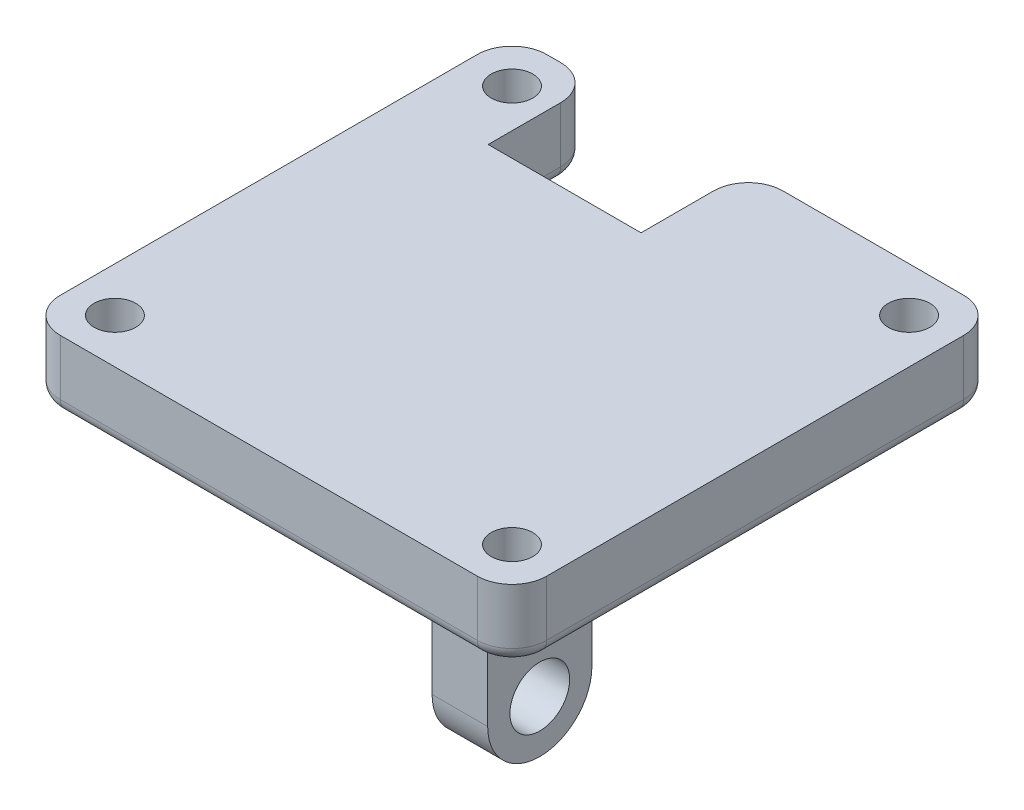
from build123d import *

# Parameters (mm, degrees)
SKETCH_2_W          = 35
SKETCH_2_H          = 35
EXTRUDE_1_DEPTH     = 5
SKETCH_3_R          = 1.5
SKETCH_3_W          = 11
SKETCH_3_H          = 7.715
CUT_EXTRUDE_1_DEPTH = 26.248762346
SKETCH_4_W          = 5
SKETCH_4_H          = 8
EXTRUDE_2_DEPTH     = 1.5
SKETCH_5_W          = 4
SKETCH_5_H          = 7.5
EXTRUDE_3_DEPTH     = 20
FILLET_1_R          = 3.75
SKETCH_6_R          = 2.15
CUT_EXTRUDE_2_DEPTH = 8
FILLET_2_R          = 2.5
FILLET_3_R          = 2.5
FILLET_4_R          = 1
FILLET_5_R          = 1
FILLET_6_R          = 1


# Some blends are built 0.0001 mm under size
with BuildPart() as part:
    # 草图2 → 凸台-拉伸1 (new body)
    with BuildSketch(Plane(origin=(0, 0, 0), x_dir=(1, 0, 0), z_dir=(0, 1, 0))):
        Rectangle(SKETCH_2_W, SKETCH_2_H)
    extrude(amount=EXTRUDE_1_DEPTH)

    # 草图3 → 切除-拉伸1 (cut, through all)
    with BuildSketch(Plane(origin=(0, 5, 0), x_dir=(1, 0, 0), z_dir=(0, 1, 0))):
        with Locations(Location((-14.285, 14.285, 0), (0, 0, 270))):
            Circle(SKETCH_3_R)
        with Locations(Location((-14.285, -14.285, 0), (0, 0, 90))):
            Circle(SKETCH_3_R)
        with Locations(Location((14.285, -14.285, 0), (0, 0, 270))):
            Circle(SKETCH_3_R)
        with Locations(Location((14.285, 14.285, 0), (0, 0, 90))):
            Circle(SKETCH_3_R)
        with Locations((-6, 13.6425)):
            Rectangle(SKETCH_3_W, SKETCH_3_H)
    extrude(amount=-CUT_EXTRUDE_1_DEPTH, mode=Mode.SUBTRACT)

    # 草图4 → 凸台-拉伸2 (add)
    with BuildSketch(Plane.XZ):
        Rectangle(SKETCH_4_W, SKETCH_4_H)
    extrude(amount=EXTRUDE_2_DEPTH)

    # 草图5 → 凸台-拉伸3 (add)
    with BuildSketch(Plane.XZ.offset(1.5)):
        Rectangle(SKETCH_5_W, SKETCH_5_H)
    extrude(amount=EXTRUDE_3_DEPTH)

    # 圆角1
    fillet_1_edges = [part.edges().sort_by_distance(p)[0] for p in [
        (0, -21.5, -3.75),
        (0, -21.5, 3.75),
    ]]
    fillet(fillet_1_edges, radius=FILLET_1_R - 0.0001)  # a hair under: the kernel refuses the full size

    # 草图6 → 切除-拉伸2 (cut)
    with BuildSketch(Plane.ZY.offset(2)):
        with Locations((0, -17.75)):
            Circle(SKETCH_6_R)
    extrude(amount=-CUT_EXTRUDE_2_DEPTH, mode=Mode.SUBTRACT)

    # 圆角2
    fillet_2_edges = [part.edges().sort_by_distance(p)[0] for p in [
        (17.5, 2.5, 17.5),
        (-17.5, 2.5, 17.5),
        (-17.5, 2.5, -17.5),
        (17.5, 2.5, -17.5),
    ]]
    fillet(fillet_2_edges, radius=FILLET_2_R)

    # 圆角3
    fillet_3_edges = [part.edges().sort_by_distance(p)[0] for p in [
        (-11.5, 2.5, -17.5),
        (-0.5, 2.5, -17.5),
    ]]
    fillet(fillet_3_edges, radius=FILLET_3_R)

    # 圆角4
    fillet_4_edges = [part.edges().sort_by_distance(p)[0] for p in [
        (-14.5, 0, -17.5),
        (-11.5, 0, -12.3925),
        (-12.232233047, 0, -16.767766953),
        (0.232233047, 0, -16.767766953),
        (-0.5, 0, -12.3925),
        (-6, 0, -9.785),
        (8.5, 0, -17.5),
        (17.5, 0, 0),
        (0, 0, 17.5),
        (-17.5, 0, 0),
        (-16.767766953, 0, -16.767766953),
        (-16.767766953, 0, 16.767766953),
        (16.767766953, 0, 16.767766953),
        (16.767766953, 0, -16.767766953),
    ]]
    fillet(fillet_4_edges, radius=FILLET_4_R)

    # 圆角5
    fillet_5_edges = [part.edges().sort_by_distance(p)[0] for p in [
        (2.5, 0, 0),
        (0, 0, 4),
        (-2.5, 0, 0),
        (0, 0, -4),
    ]]
    fillet(fillet_5_edges, radius=FILLET_5_R)

    # 圆角6
    # the kernel refuses this fillet: 1 mm, written as the material it takes off along each edge
    with BuildSketch(Plane(origin=(-3.961914255, -1.5, -4), x_dir=(0, 0.9999810692345785, -0.006153143299889555), z_dir=(1, 0, 0)), Plane(origin=(3.961914255, -1.5, 4), x_dir=(0, 0.9999810692345785, 0.006153143299889555), z_dir=(-1, 0, 0))) as fillet_6_piece_1:
        with BuildLine():
            CenterArc((0.663387726, 0.996904498), FILLET_6_R, 228.323350496, 37.167285461)
            Line((-0.001538286, 0.249995267), (-0.068030887, 0.175304344))
            ThreePointArc((-0.068030887, 0.175304344), (-0.10076725, 0.124382319), (-0.099998107, -0.000615314))
            Line((-0.099998107, -0.000615314), (0.000615314, -0.099998107))
            ThreePointArc((0.000615314, -0.099998107), (0.500605849, -0.096921535), (0.5769035, -0.09969045))
            Line((0.5769035, -0.09969045), (0.584765702, 0))
        make_face()
    extrude(amount=7.923828511, mode=Mode.SUBTRACT)
    with BuildSketch(Plane(origin=(-2.5, -1.5, 5.734079277), x_dir=(-0.027211919166029507, 0.9996296871618517, 0), z_dir=(0, 0, -1)), Plane(origin=(2.5, -1.5, -5.734079277), x_dir=(0.02721191916602949, 0.9996296871618517, 0), z_dir=(0, 0, 1))) as fillet_6_piece_2:
        with BuildLine():
            CenterArc((0.860236658, 0.986023728), FILLET_6_R, 209.091705597, 51.317812547)
            Line((-0.01360596, 0.499814844), (-0.100990221, 0.451193955))
            ThreePointArc((-0.100990221, 0.451193955), (-0.106765949, 0.24718623), (-0.099962969, -0.002721192))
            Line((-0.099962969, -0.002721192), (0.002721192, -0.099962969))
            ThreePointArc((0.002721192, -0.099962969), (0.502536035, -0.086357009), (0.676971216, -0.098602373))
            Line((0.676971216, -0.098602373), (0.693631711, 0))
        make_face()
    extrude(amount=11.468158553, mode=Mode.SUBTRACT)


solid = part.part
